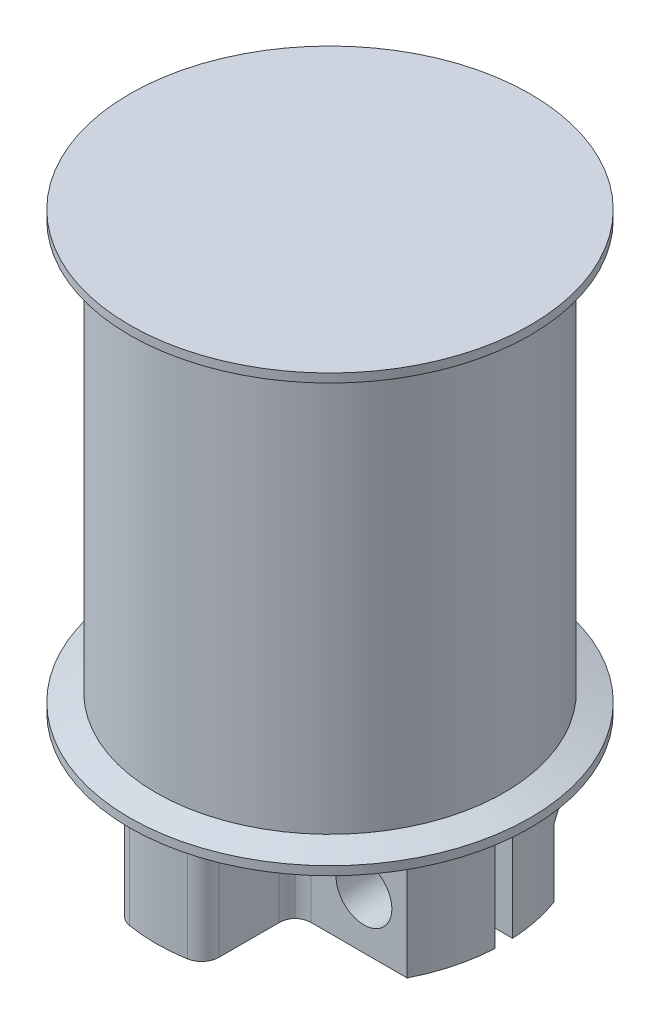
from build123d import *

# Parameters (mm, degrees)
CUT_EXTRUDE1_DEPTH      = 6.5
INTERSECT1_START        = -6.5
INTERSECT1_DEPTH        = 6
INTERSECT1_2_DEPTH      = 6.5
CUT_EXTRUDE2_DEPTH      = 1
CUT_EXTRUDE2_DEPTH_BACK = 31.020826105
SKETCH5_R               = 1.6
CUT_EXTRUDE3_START      = -3
SKETCH5_3_R             = 3.05
SKETCH5_3_R_2           = 1.6
CUT_EXTRUDE3_DEPTH      = 28.020826105
SKETCH5_4_R             = 1.6
CUT_EXTRUDE4_DEPTH      = 31.020826105
CUT_EXTRUDE5_DEPTH      = 6
CHAMFER1_SIZE           = 0.5
FILLET1_R               = 1
FILLET2_R               = 1
INTERSECT2_START        = -10.0000001
INTERSECT2_DEPTH        = 6.5000001


with BuildPart() as part:
    # Sketch2 → Revolve1 (revolve)
    with BuildSketch(Plane.XY, mode=Mode.PRIVATE) as revolve1_sk:
        Polygon((2.5, 0), (2.5, 10), (0, 10), (0, 25), (2.5, 25), (11.5, 25), (11.5, 24.5), (10, 24), (10, 1), (11.5, 0.5), (11.5, 0), (10, 0), (10, -0.5), (10, -6.5), (2.5, -6.5), align=None)
    revolve(revolve1_sk.sketch.rotate(Axis((0, 25, 0), (0, -1, 0)), 90), axis=Axis((0, 25, 0), (0, -1, 0)))

    # Sketch3 → Cut-Extrude1 (cut)
    with BuildSketch(Plane.XZ.offset(6.5)):
        with BuildLine():
            Line((-9.987492178, -0.5), (-2.449489743, -0.5))
            ThreePointArc((-2.449489743, -0.5), (-2.5, 0), (-2.449489743, 0.5))
            Line((-2.449489743, 0.5), (-9.987492178, 0.5))
            ThreePointArc((-9.987492178, 0.5), (-10, 0), (-9.987492178, -0.5))
        make_face()
        with BuildLine():
            ThreePointArc((2.5, 0), (2.487340383, -0.251272405), (2.449489743, -0.5))
            Line((2.449489743, -0.5), (9.987492178, -0.5))
            ThreePointArc((9.987492178, -0.5), (9.996872555, -0.250078211), (10, 0))
            ThreePointArc((10, 0), (9.996872555, 0.250078211), (9.987492178, 0.5))
            Line((9.987492178, 0.5), (2.449489743, 0.5))
            ThreePointArc((2.449489743, 0.5), (2.487340383, 0.251272405), (2.5, 0))
        make_face()
    extrude(amount=-CUT_EXTRUDE1_DEPTH, mode=Mode.SUBTRACT)

    # Intersect1 2 outline → Intersect1 2 (cut)
    with BuildSketch(Plane(origin=(0, 0, 0), x_dir=(1, 0, 0), z_dir=(0, 1, 0)).offset(INTERSECT1_START)):
        with BuildLine():
            Line((-2.449489743, -0.5), (-9.987492178, -0.5))
            ThreePointArc((-9.987492178, -0.5), (0, -10), (9.987492178, -0.5))
            Line((9.987492178, -0.5), (2.449489743, -0.5))
            ThreePointArc((2.449489743, -0.5), (0, -2.5), (-2.449489743, -0.5))
        make_face()
    extrude(amount=INTERSECT1_2_DEPTH, mode=Mode.SUBTRACT)

    # Sketch5 → Cut-Extrude2 (cut, two sides: drawn at the far end of the back side and taken through both)
    with BuildSketch(Plane.XY.offset(-0.5).offset(-CUT_EXTRUDE2_DEPTH_BACK)):
        with Locations(Location((-6.449489743, -3.5, 0), (0, 0, 180))):
            Circle(SKETCH5_R)
        with Locations(Location((6.449489743, -3.5, 0), (0, 0, 180))):
            Circle(SKETCH5_R)
    extrude(amount=CUT_EXTRUDE2_DEPTH + CUT_EXTRUDE2_DEPTH_BACK, mode=Mode.SUBTRACT)

    # Sketch5<3> → Cut-Extrude3 (cut, through all)
    # profile 1 of 2: a face of its own
    with BuildSketch(Plane.XY.offset(-0.5).offset(CUT_EXTRUDE3_START)):
        with Locations((-6.449489743, -3.5)):
            Circle(SKETCH5_3_R)
        with Locations((-6.449489743, -3.5)):
            Circle(SKETCH5_3_R_2, mode=Mode.SUBTRACT)
    # profile 2 of 2: a face of its own
    with BuildSketch(Plane.XY.offset(-0.5).offset(CUT_EXTRUDE3_START)):
        with Locations((6.449489743, -3.5)):
            Circle(SKETCH5_3_R)
        with Locations(Location((6.449489743, -3.5, 0), (0, 0, 180))):
            Circle(SKETCH5_3_R_2, mode=Mode.SUBTRACT)
    extrude(amount=-CUT_EXTRUDE3_DEPTH, mode=Mode.SUBTRACT)

    # Fillet2
    # the kernel refuses this fillet: 1 mm, written as the material it takes off along each edge
    with BuildSketch(Plane(origin=(5.899489743, -6.5, -15.503701116), x_dir=(-0.8151459123720453, 0.5792556789045281, 0), z_dir=(0, 0, 1))) as fillet2_piece_1:
        with BuildLine():
            CenterArc((3.001639729, 0.906238807), FILLET2_R, 125.398208072, 119.592441671)
            Line((2.42238405, 1.721384719), (0, 0))
            ThreePointArc((0, 0), (1.289436785, 0.285971639), (2.57887357, 0))
        make_face()
    extrude(amount=12.003701116, mode=Mode.SUBTRACT)
    with BuildSketch(Plane(origin=(6.999489743, -6.5, -14.571224371), x_dir=(0.8151459123720456, 0.5792556789045277, 0), z_dir=(0, 0, 1))) as fillet2_piece_2:
        with BuildLine():
            CenterArc((3.001639729, -0.906238807), FILLET2_R, 115.009350257, 119.592441671)
            Line((2.42238405, -1.721384719), (0, 0))
            ThreePointArc((0, 0), (1.289436785, -0.285971639), (2.57887357, 0))
        make_face()
    extrude(amount=11.071224371, mode=Mode.SUBTRACT)
    with BuildSketch(Plane(origin=(-6.999489743, -6.5, -14.571224371), x_dir=(-0.8151459123720448, 0.5792556789045287, 0), z_dir=(0, 0, 1))) as fillet2_piece_3:
        with BuildLine():
            CenterArc((3.001639729, 0.906238807), FILLET2_R, 125.398208072, 119.592441671)
            Line((2.42238405, 1.721384719), (0, 0))
            ThreePointArc((0, 0), (1.289436785, 0.285971639), (2.57887357, 0))
        make_face()
    extrude(amount=11.071224371, mode=Mode.SUBTRACT)
    with BuildSketch(Plane(origin=(-5.899489743, -6.5, -15.503701116), x_dir=(0.8151459123720447, 0.579255678904529, 0), z_dir=(0, 0, 1))) as fillet2_piece_4:
        with BuildLine():
            CenterArc((3.001639729, -0.906238807), FILLET2_R, 115.009350257, 119.592441671)
            Line((2.42238405, -1.721384719), (0, 0))
            ThreePointArc((0, 0), (1.289436785, -0.285971639), (2.57887357, 0))
        make_face()
    extrude(amount=12.003701116, mode=Mode.SUBTRACT)

    # Intersect2: read off the stored shape, not the designer's step
    # Intersect2 outline → Intersect2 (cut)
    with BuildSketch(Plane.XY.offset(INTERSECT2_START)):
        with BuildLine():
            ThreePointArc((-9.101644142, -5.006179618), (-9.251694739, -4.704220561), (-9.367496998, -4.387543611))
            Line((-9.367496998, -4.387543611), (-9.789533465, -3))
            Line((-9.789533465, -3), (-11, -3))
            Line((-11, -3), (-11, -7.533475387))
            Line((-11, -7.533475387), (-9.367496998, -6.297203197))
            ThreePointArc((-9.367496998, -6.297203197), (-8.991758319, -5.70168832), (-9.101644142, -5.006179618))
        make_face()
        with BuildLine():
            Line((11, -3), (9.789533466, -3))
            Line((9.789533466, -3), (9.367496998, -4.387543611))
            ThreePointArc((9.367496998, -4.387543611), (9.251696278, -4.70421698), (9.101647992, -5.00617284))
            ThreePointArc((9.101647992, -5.00617284), (8.991758319, -5.70168832), (9.367496998, -6.297203197))
            Line((9.367496998, -6.297203197), (11, -7.533475387))
            Line((11, -7.533475387), (11, -3))
        make_face()
    extrude(amount=INTERSECT2_DEPTH, mode=Mode.SUBTRACT)


with BuildPart() as body_2:
    # Intersect1: read off the stored shape, not the designer's step
    # Intersect1 outline → Intersect1 (new body)
    with BuildSketch(Plane(origin=(0, 0, 0), x_dir=(1, 0, 0), z_dir=(0, 1, 0)).offset(INTERSECT1_START)):
        with BuildLine():
            ThreePointArc((2.449489743, -0.5), (0, -2.5), (-2.449489743, -0.5))
            Line((-2.449489743, -0.5), (-9.987492178, -0.5))
            ThreePointArc((-9.987492178, -0.5), (0, -10), (9.987492178, -0.5))
            Line((9.987492178, -0.5), (2.449489743, -0.5))
        make_face()
    extrude(amount=INTERSECT1_DEPTH)

    # Sketch5<4> → Cut-Extrude4 (cut, through all)
    with BuildSketch(Plane.XY.offset(-0.5)):
        with Locations(Location((-6.449489743, -3.5, 0), (0, 0, 180))):
            Circle(SKETCH5_4_R)
        with Locations(Location((6.449489743, -3.5, 0), (0, 0, 180))):
            Circle(SKETCH5_4_R)
    extrude(amount=CUT_EXTRUDE4_DEPTH, mode=Mode.SUBTRACT)

    # Sketch7 → Cut-Extrude5 (cut)
    with BuildSketch(Plane.XZ.offset(6.5)):
        with BuildLine():
            ThreePointArc((-2.5, 9.682458366), (-6.275135506, 7.786056408), (-8.93028555, 4.5))
            Line((-8.93028555, 4.5), (-2.5, 4.5))
            Line((-2.5, 4.5), (-2.5, 9.682458366))
        make_face()
        with BuildLine():
            Line((2.5, 9.682458366), (2.5, 4.5))
            Line((2.5, 4.5), (8.93028555, 4.5))
            ThreePointArc((8.93028555, 4.5), (6.275135506, 7.786056408), (2.5, 9.682458366))
        make_face()
    extrude(amount=-CUT_EXTRUDE5_DEPTH, mode=Mode.SUBTRACT)

    # Chamfer1
    chamfer1_edges = [body_2.edges().sort_by_distance(p)[0] for p in [
        (-2.5, -3.5, 4.5),
        (2.5, -3.5, 4.5),
    ]]
    chamfer(chamfer1_edges, length=CHAMFER1_SIZE)

    # Fillet1
    # the kernel refuses this fillet: 1 mm, written as the material it adds along each edge
    with BuildSketch(Plane(origin=(3, -6.5, 4.5), x_dir=(1, 0, 0), z_dir=(0, 1, 0)), Plane(origin=(2.5, -6.5, 5), x_dir=(0.7071067811865481, 0, -0.707106781186547), z_dir=(0, 1, 0)), Plane(origin=(-2.5, -6.5, 5), x_dir=(0, 0, 1), z_dir=(0, 1, 0)), Plane(origin=(-3, -6.5, 4.5), x_dir=(0.7071067811865481, 0, 0.707106781186547), z_dir=(0, 1, 0))) as fillet1_piece_1:
        with BuildLine():
            CenterArc((FILLET1_R * 0.414213562373, -FILLET1_R), FILLET1_R, 90, 45)
            Line((-FILLET1_R * 0.292893218813, -FILLET1_R * 0.292893218813), (0, 0))
            Line((0, 0), (FILLET1_R * 0.414213562373, 0))
        make_face()
    extrude(amount=6)
    # the kernel refuses this fillet: 1 mm, written as the material it takes off along each edge
    with BuildSketch(Plane(origin=(-2.5, -8.630159487, 9.682458366), x_dir=(0.9780175364256274, 0, 0.20852265690794025), z_dir=(0, 1, 0))) as fillet1_2_piece_1:
        with BuildLine():
            CenterArc((0.809460605, 0.999092072), FILLET1_R, 192.035790207, 80.405931773)
            Line((-0.168556932, 0.790569415), (0, 0))
            ThreePointArc((0, 0), (0.426031897, -0.009079281), (0.852063795, 0))
        make_face()
    extrude(amount=10.260318973, mode=Mode.SUBTRACT)
    with BuildSketch(Plane(origin=(2.5, -8.630159487, 9.682458366), x_dir=(0, 0, -1), z_dir=(0, 1, 0))) as fillet1_2_piece_2:
        with BuildLine():
            CenterArc((0.808338691, 1), FILLET1_R, 189.594068227, 80.405931773)
            ThreePointArc((-0.177674606, 0.833333333), (-0.097716999, 0.414773431), (0, 0))
            Line((0, 0), (0.808338691, 0))
        make_face()
    extrude(amount=10.260318973, mode=Mode.SUBTRACT)


solid = Compound([part.part, body_2.part])
